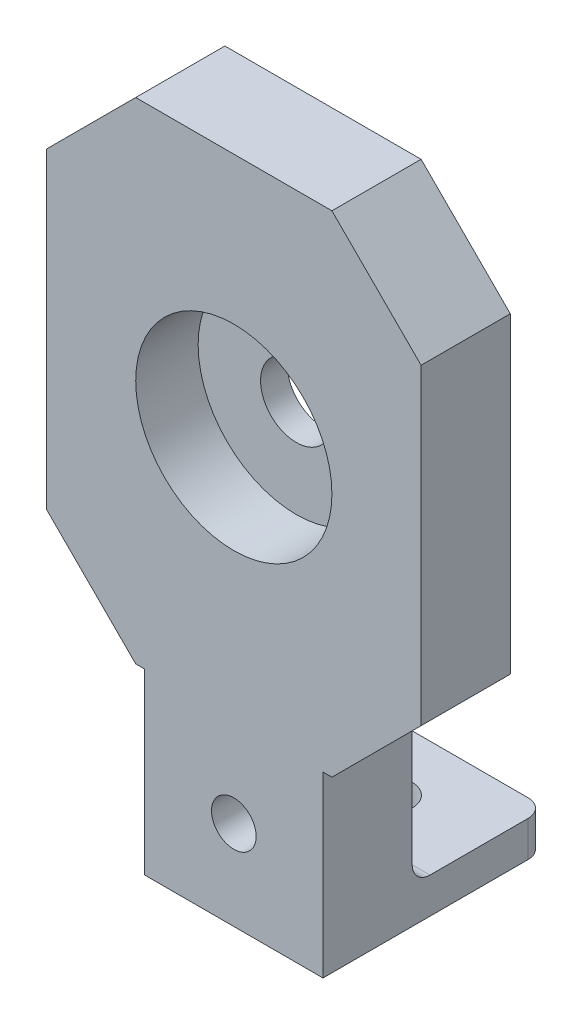
from build123d import *

# Parameters (mm, degrees)
ESTRUSIONE_ESTRUSIONE1_DEPTH = 10
SCHIZZO6_R                   = 11
TAGLIO_ESTRUSIONE4_DEPTH     = 7
SCHIZZO7_R                   = 4
TAGLIO_ESTRUSIONE5_DEPTH     = 53.404675364
SMUSSO2_SIZE                 = 10
SCHIZZO8_W                   = 20
SCHIZZO8_H                   = 4
ESTRUSIONE_ESTRUSIONE3_DEPTH = 15
SCHIZZO9_R                   = 2.5
TAGLIO_ESTRUSIONE6_DEPTH     = 35
RACCORDO1_R                  = 2
SCHIZZO10_R                  = 2.5
TAGLIO_ESTRUSIONE7_DEPTH     = 10


with BuildPart() as part:
    # Schizzo1 → Estrusione-Estrusione1 (new body)
    with BuildSketch(Plane.XY):
        Polygon((-10, -47.5), (10, -47.5), (10, -27.5), (21, -27.5), (21, 27.5), (-21, 27.5), (-21, -27.5), (-10, -27.5), align=None)
    extrude(amount=ESTRUSIONE_ESTRUSIONE1_DEPTH)

    # Schizzo6 → Taglio-Estrusione4 (cut)
    with BuildSketch(Plane.XY.offset(10)):
        Circle(SCHIZZO6_R)
    extrude(amount=-TAGLIO_ESTRUSIONE4_DEPTH, mode=Mode.SUBTRACT)

    # Schizzo7 → Taglio-Estrusione5 (cut, through all)
    with BuildSketch(Plane.XY.offset(3)):
        Circle(SCHIZZO7_R)
    extrude(amount=-TAGLIO_ESTRUSIONE5_DEPTH, mode=Mode.SUBTRACT)

    # Smusso2
    smusso2_edges = [part.edges().sort_by_distance(p)[0] for p in [
        (-21, -27.5, 5),
        (21, -27.5, 5),
        (21, 27.5, 5),
        (-21, 27.5, 5),
    ]]
    chamfer(smusso2_edges, length=SMUSSO2_SIZE)

    # Schizzo8 → Estrusione-Estrusione3 (add)
    with BuildSketch(Plane(origin=(0, 0, 0), x_dir=(-1, 0, 0), z_dir=(0, 0, -1))):
        with Locations((0, -45.5)):
            Rectangle(SCHIZZO8_W, SCHIZZO8_H)
    extrude(amount=ESTRUSIONE_ESTRUSIONE3_DEPTH)

    # Schizzo9 → Taglio-Estrusione6 (cut)
    with BuildSketch(Plane(origin=(0, -43.5, 0), x_dir=(1, 0, 0), z_dir=(0, 1, 0))):
        with Locations((0, 7.5)):
            Circle(SCHIZZO9_R)
    extrude(amount=-TAGLIO_ESTRUSIONE6_DEPTH, mode=Mode.SUBTRACT)

    # Raccordo1
    raccordo1_edges = [part.edges().sort_by_distance(p)[0] for p in [
        (0, -43.5, 0),
        (-10, -45.5, -15),
        (10, -45.5, -15),
    ]]
    fillet(raccordo1_edges, radius=RACCORDO1_R)

    # Schizzo10 → Taglio-Estrusione7 (cut)
    with BuildSketch(Plane(origin=(0, 0, 0), x_dir=(-1, 0, 0), z_dir=(0, 0, -1))):
        with Locations((0, -37.5)):
            Circle(SCHIZZO10_R)
    extrude(amount=-TAGLIO_ESTRUSIONE7_DEPTH, mode=Mode.SUBTRACT)


solid = part.part
